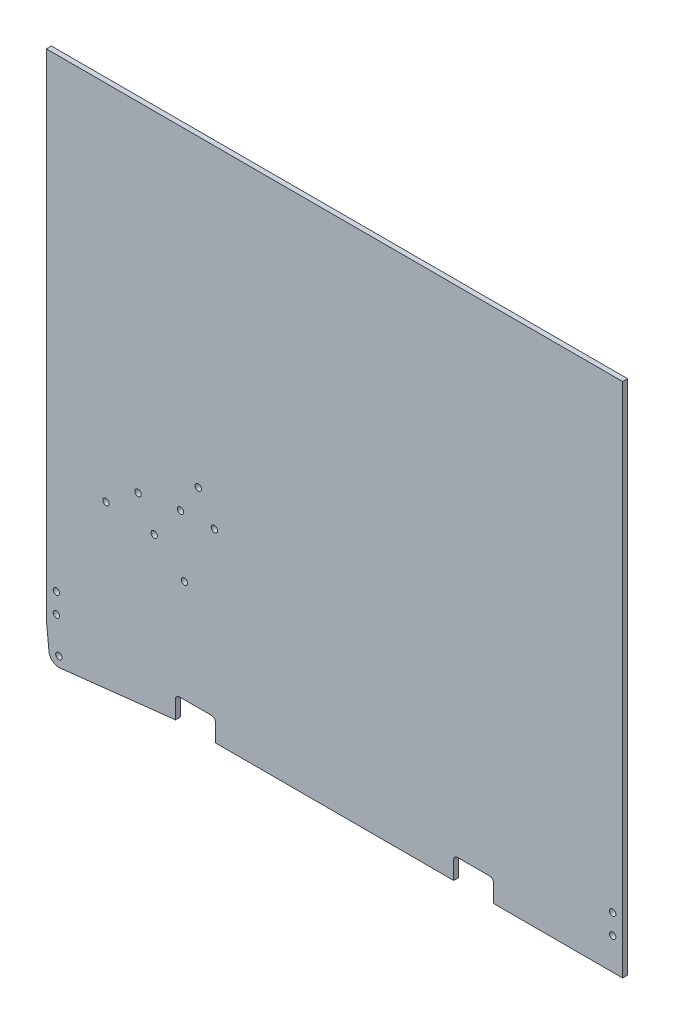
from build123d import *

# Parameters (mm, degrees)
SKETCH1_R           = 2.032
BOSS_EXTRUDE1_DEPTH = 3.175
FILLET1_R           = 2.286


with BuildPart() as part:
    # Sketch1 → Boss-Extrude1 (new body)
    with BuildSketch(Plane.XY):
        with BuildLine():
            Line((82.55, -20.32), (82.55, -6.35))
            Line((82.55, -6.35), (107.95, -6.35))
            Line((107.95, -6.35), (107.95, -20.32))
            Line((107.95, -20.32), (260.35, -20.32))
            Line((260.35, -20.32), (260.35, -6.35))
            Line((260.35, -6.35), (285.75, -6.35))
            Line((285.75, -6.35), (285.75, -20.32))
            Line((285.75, -20.32), (368.3, -20.32))
            Line((368.3, -20.32), (368.3, 309.88))
            Line((368.3, 309.88), (0, 309.88))
            Line((0, 309.88), (0, 0))
            Line((0, 0), (0, -6.35))
            ThreePointArc((0, -6.35), (0.007883354, -6.666317007), (0.031513842, -6.981848616))
            Line((0.031513842, -6.981848616), (1.619013842, -22.856848616))
            ThreePointArc((1.619013842, -22.856848616), (3.943628298, -27.161748811), (8.639060666, -28.536126099))
            Line((8.639060666, -28.536126099), (82.55, -20.32))
        make_face()
        with Locations((6.35, 0)):
            Circle(SKETCH1_R, mode=Mode.SUBTRACT)
        with Locations((6.35, 12.7)):
            Circle(SKETCH1_R, mode=Mode.SUBTRACT)
        with Locations((361.95, 0)):
            Circle(SKETCH1_R, mode=Mode.SUBTRACT)
        with Locations((361.95, 12.7)):
            Circle(SKETCH1_R, mode=Mode.SUBTRACT)
        with Locations((7.9375, -22.225)):
            Circle(SKETCH1_R, mode=Mode.SUBTRACT)
        with Locations((38.1, 78.105)):
            Circle(SKETCH1_R, mode=Mode.SUBTRACT)
        with Locations((85.725, 97.155)):
            Circle(SKETCH1_R, mode=Mode.SUBTRACT)
        with Locations((58.568579744, 93.391299635)):
            Circle(SKETCH1_R, mode=Mode.SUBTRACT)
        with Locations((68.887329744, 75.518700365)):
            Circle(SKETCH1_R, mode=Mode.SUBTRACT)
        with Locations((107.382158942, 97.743700365)):
            Circle(SKETCH1_R, mode=Mode.SUBTRACT)
        with Locations((97.063408942, 115.616299635)):
            Circle(SKETCH1_R, mode=Mode.SUBTRACT)
        with Locations((88.216909404, 59.136578314)):
            Circle(SKETCH1_R, mode=Mode.SUBTRACT)
    extrude(amount=BOSS_EXTRUDE1_DEPTH)

    # Fillet1
    fillet1_edges = [part.edges().sort_by_distance(p)[0] for p in [
        (285.75, -6.35, 1.5875),
        (107.95, -6.35, 1.5875),
        (260.35, -6.35, 1.5875),
        (82.55, -6.35, 1.5875),
    ]]
    fillet(fillet1_edges, radius=FILLET1_R)


solid = part.part
